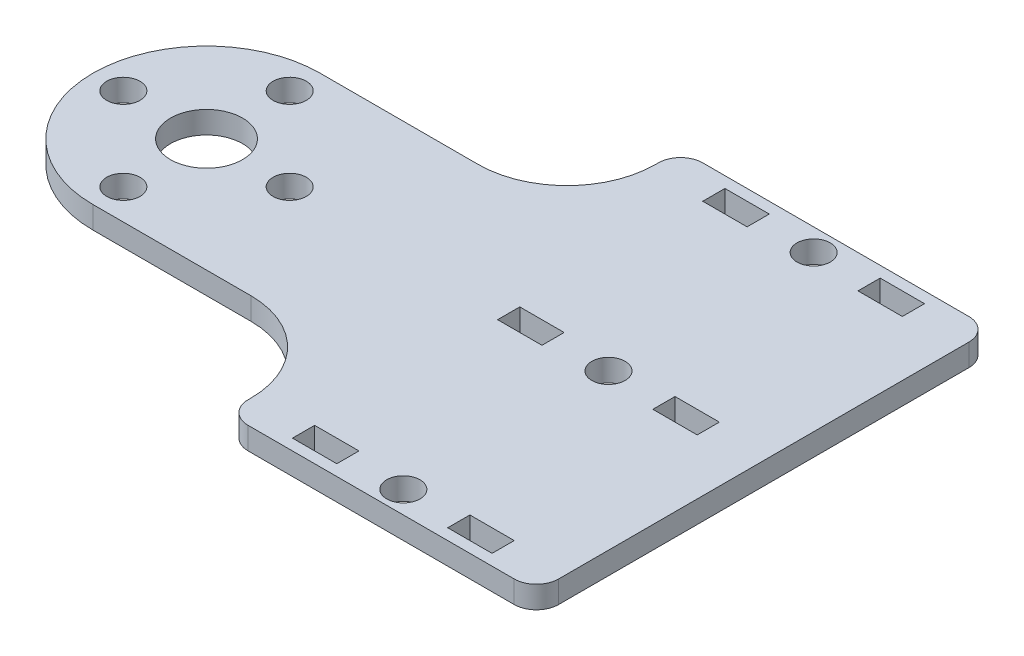
from build123d import *

# Parameters (mm, degrees)
SKETCH1_R           = 3.25
SKETCH1_R_2         = 1.5
BOSS_EXTRUDE1_DEPTH = 2
FILLET1_R           = 10.25
FILLET2_R           = 2
SKETCH2_R           = 1.5
SKETCH2_W           = 4
SKETCH2_H           = 2
CUT_EXTRUDE1_DEPTH  = 2
FILLET3_R           = 8


with BuildPart() as part:
    # Sketch1 → Boss-Extrude1 (new body)
    with BuildSketch(Plane(origin=(0, 0, 0), x_dir=(1, 0, 0), z_dir=(0, 1, 0))):
        Polygon((0, 0), (32.5, 0), (32.5, -10.25), (60.5, -10.25), (60.5, -0.75), (60.5, 21.25), (60.5, 30.75), (32.5, 30.75), (32.5, 20.5), (0, 20.5), align=None)
        with Locations(Location((10.25, 10.25, 0), (0, 0, 270))):
            Circle(SKETCH1_R, mode=Mode.SUBTRACT)
        with Locations(Location((2.75, 10.25, 0), (0, 0, 270))):
            Circle(SKETCH1_R_2, mode=Mode.SUBTRACT)
        with Locations(Location((10.25, 17.75, 0), (0, 0, 90))):
            Circle(SKETCH1_R_2, mode=Mode.SUBTRACT)
        with Locations(Location((17.75, 10.25, 0), (0, 0, 270))):
            Circle(SKETCH1_R_2, mode=Mode.SUBTRACT)
        with Locations(Location((10.25, 2.75, 0), (0, 0, 90))):
            Circle(SKETCH1_R_2, mode=Mode.SUBTRACT)
    extrude(amount=BOSS_EXTRUDE1_DEPTH)

    # Fillet1
    fillet1_edges = [part.edges().sort_by_distance(p)[0] for p in [
        (0, 1, -20.5),
        (0, 1, 0),
    ]]
    fillet(fillet1_edges, radius=FILLET1_R - 0.0001)  # a hair under: the kernel refuses the full size

    # Fillet2
    fillet2_edges = [part.edges().sort_by_distance(p)[0] for p in [
        (32.5, 1, -30.75),
        (60.5, 1, -30.75),
        (60.5, 1, 10.25),
        (32.5, 1, 10.25),
    ]]
    fillet(fillet2_edges, radius=FILLET2_R)

    # Sketch2 → Cut-Extrude1 (cut)
    with BuildSketch(Plane(origin=(0, 2, 0), x_dir=(1, 0, 0), z_dir=(0, 1, 0))):
        with Locations(Location((46.5, 28.75, 0), (0, 0, 270))):
            Circle(SKETCH2_R)
        with Locations(Location((46.5, 10.25, 0), (0, 0, 270))):
            Circle(SKETCH2_R)
        with Locations(Location((46.5, -8.25, 0), (0, 0, 270))):
            Circle(SKETCH2_R)
        with Locations((39.5, 28.75)):
            Rectangle(SKETCH2_W, SKETCH2_H)
        with Locations((53.5, 28.75)):
            Rectangle(SKETCH2_W, SKETCH2_H)
        with Locations((39.5, 10.25)):
            Rectangle(SKETCH2_W, SKETCH2_H)
        with Locations((53.5, 10.25)):
            Rectangle(SKETCH2_W, SKETCH2_H)
        with Locations((39.5, -8.25)):
            Rectangle(SKETCH2_W, SKETCH2_H)
        with Locations((53.5, -8.25)):
            Rectangle(SKETCH2_W, SKETCH2_H)
    extrude(amount=-CUT_EXTRUDE1_DEPTH, mode=Mode.SUBTRACT)

    # Fillet3
    fillet3_edges = [part.edges().sort_by_distance(p)[0] for p in [
        (32.5, 1, -20.5),
        (32.5, 1, 0),
    ]]
    fillet(fillet3_edges, radius=FILLET3_R)


solid = part.part
